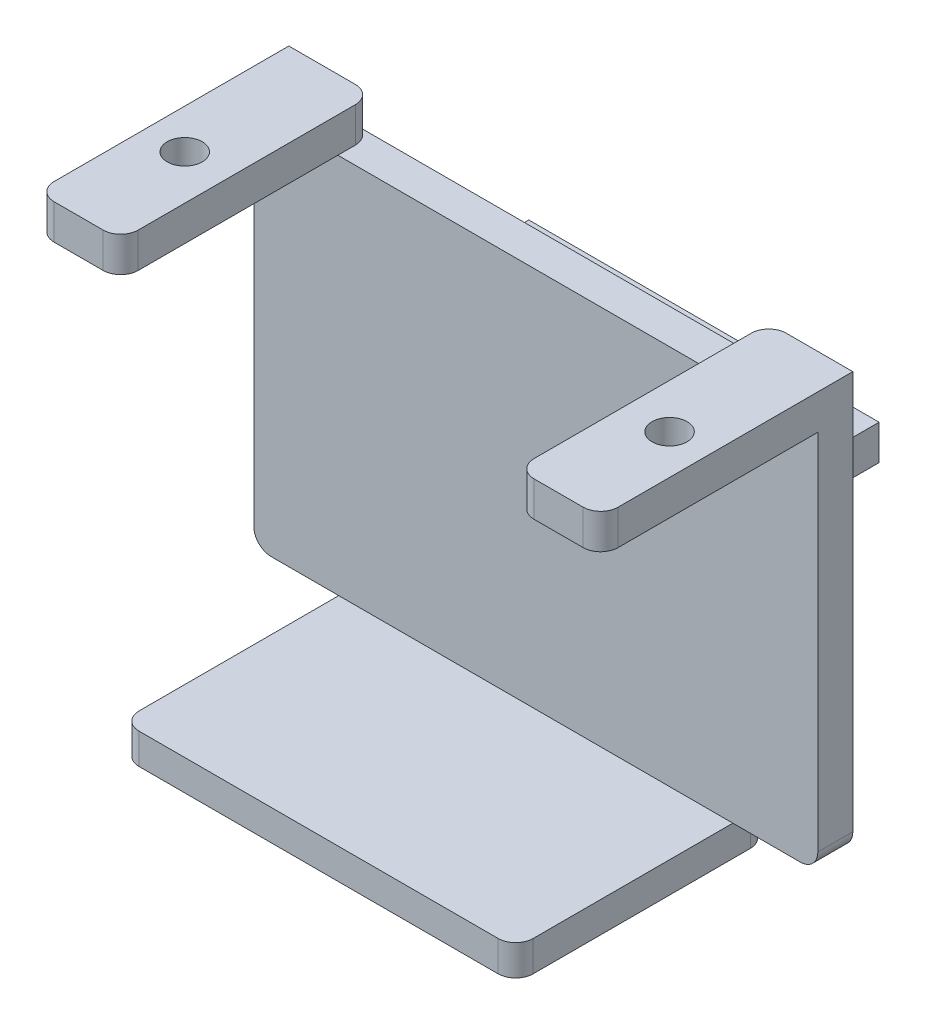
from build123d import *

# Parameters (mm, degrees)
SKETCH1_W           = 32.2
SKETCH1_H           = 25.5
BOSS_EXTRUDE1_DEPTH = 14.4
SKETCH3_W           = 32.2
SKETCH3_H           = 21.75
CUT_EXTRUDE1_DEPTH  = 12.4
SKETCH5_W           = 22.6
SKETCH5_H           = 2
CUT_EXTRUDE2_DEPTH  = 14.4
FILLET1_R           = 1
FILLET2_R           = 1
FILLET3_R           = 1
FILLET4_R           = 1
SKETCH10_R          = 1
CUT_EXTRUDE3_DEPTH  = 10
SKETCH11_W          = 4.85
SKETCH11_H          = 1.75
CUT_EXTRUDE4_DEPTH  = 20
FILLET5_R           = 1
FILLET6_R           = 1
SKETCH12_W          = 20
SKETCH12_H          = 2
BOSS_EXTRUDE2_DEPTH = 5


with BuildPart() as part:
    # Sketch1 → Boss-Extrude1 (new body)
    with BuildSketch(Plane.XY):
        Rectangle(SKETCH1_W, SKETCH1_H)
    extrude(amount=BOSS_EXTRUDE1_DEPTH)

    # Sketch3 → Cut-Extrude1 (cut)
    with BuildSketch(Plane.XY.offset(14.4)):
        with Locations((0, -0.125)):
            Rectangle(SKETCH3_W, SKETCH3_H)
    extrude(amount=-CUT_EXTRUDE1_DEPTH, mode=Mode.SUBTRACT)

    # Sketch5 → Cut-Extrude2 (cut)
    with BuildSketch(Plane.XY.offset(14.4)):
        with Locations((0, 11.75)):
            Rectangle(SKETCH5_W, SKETCH5_H)
    extrude(amount=-CUT_EXTRUDE2_DEPTH, mode=Mode.SUBTRACT)

    # Fillet1
    fillet1_edges = [part.edges().sort_by_distance(p)[0] for p in [
        (-11.3, 11.75, 14.4),
    ]]
    fillet(fillet1_edges, radius=FILLET1_R)

    # Fillet2
    fillet2_edges = [part.edges().sort_by_distance(p)[0] for p in [
        (-16.1, 11.75, 14.4),
    ]]
    fillet(fillet2_edges, radius=FILLET2_R)

    # Fillet3
    fillet3_edges = [part.edges().sort_by_distance(p)[0] for p in [
        (11.3, 11.75, 14.4),
    ]]
    fillet(fillet3_edges, radius=FILLET3_R)

    # Fillet4
    fillet4_edges = [part.edges().sort_by_distance(p)[0] for p in [
        (16.1, 11.75, 14.4),
    ]]
    fillet(fillet4_edges, radius=FILLET4_R)

    # Sketch10 → Cut-Extrude3 (cut)
    with BuildSketch(Plane(origin=(0, 12.75, 0), x_dir=(1, 0, 0), z_dir=(0, 1, 0))):
        with Locations((-13.84, -8.203047487)):
            Circle(SKETCH10_R)
    cut_extrude3 = extrude(amount=-CUT_EXTRUDE3_DEPTH, mode=Mode.SUBTRACT)

    # Mirror1: Cut-Extrude3 across plane
    add(cut_extrude3.mirror(Plane(origin=(0, 0, 0), x_dir=(0, 0, 1), z_dir=(1, 0, 0))), mode=Mode.SUBTRACT)

    # Sketch11 → Cut-Extrude4 (cut)
    with BuildSketch(Plane.XY.offset(14.4)):
        with Locations((-13.675, -11.875)):
            Rectangle(SKETCH11_W, SKETCH11_H)
    cut_extrude4 = extrude(amount=-CUT_EXTRUDE4_DEPTH, mode=Mode.SUBTRACT)

    # Mirror2: Cut-Extrude4 across plane
    add(cut_extrude4.mirror(Plane(origin=(0, 0, 0), x_dir=(0, 0, 1), z_dir=(1, 0, 0))), mode=Mode.SUBTRACT)

    # Fillet5
    fillet5_edges = [part.edges().sort_by_distance(p)[0] for p in [
        (-11.25, -11.875, 0),
        (-16.1, -11, 1),
        (16.1, -11, 1),
        (11.25, -11.875, 0),
        (11.25, -11.875, 14.4),
        (-11.25, -11.875, 14.4),
    ]]
    fillet(fillet5_edges, radius=FILLET5_R)

    # Fillet6
    fillet6_edges = [part.edges().sort_by_distance(p)[0] for p in [
        (-11.3, 11.75, 0),
        (11.3, 11.75, 0),
    ]]
    fillet(fillet6_edges, radius=FILLET6_R)

    # Sketch12 → Boss-Extrude2 (add)
    with BuildSketch(Plane(origin=(0, 0, 0), x_dir=(-1, 0, 0), z_dir=(0, 0, -1))):
        with Locations((-2.6, 5)):
            Rectangle(SKETCH12_W, SKETCH12_H)
    extrude(amount=BOSS_EXTRUDE2_DEPTH)


solid = part.part
